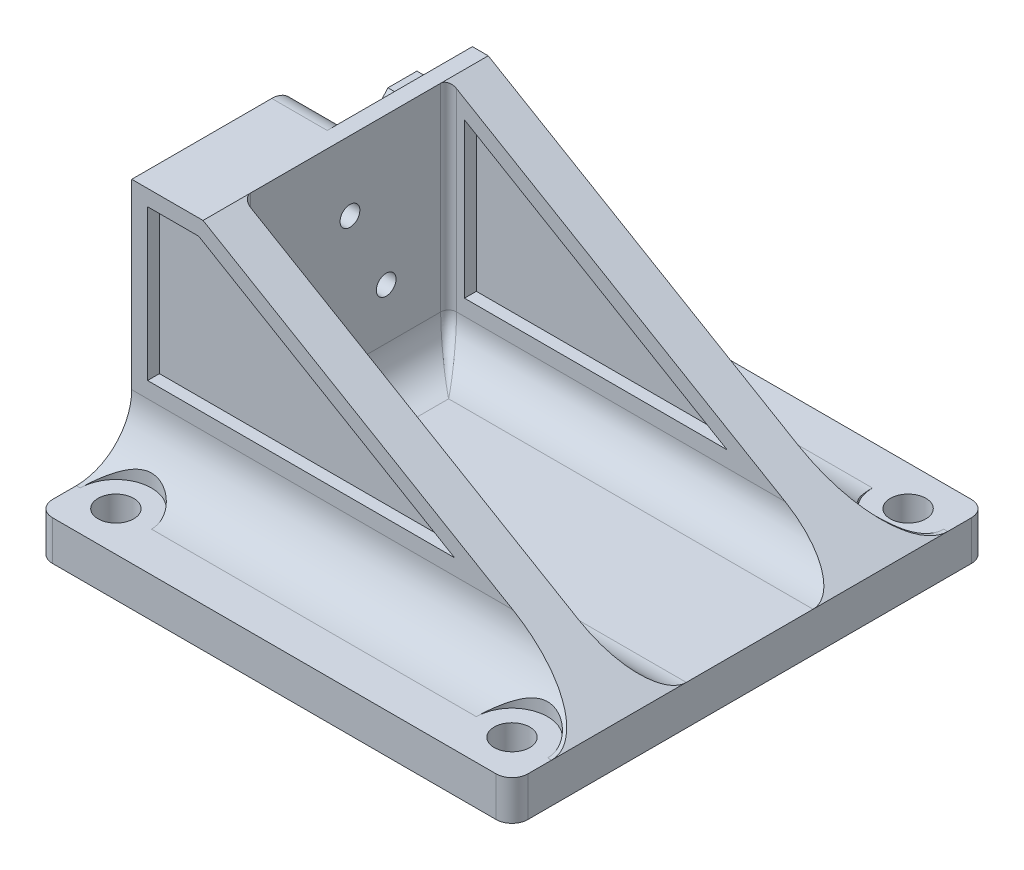
from build123d import *

# Parameters (mm, degrees)
SKETCH2_W                     = 60
SKETCH2_H                     = 60
BOSS_EXTRUDE1_DEPTH           = 5
SKETCH5_W                     = 9
SKETCH5_H                     = 36
BOSS_EXTRUDE2_DEPTH           = 30
BOSS_EXTRUDE3_DEPTH           = 5
BOSS_EXTRUDE4_DEPTH           = 5
FILLET6_R                     = 7
SKETCH4_W                     = 2.25
SKETCH4_H                     = 5
M4_CLEARANCE_HOLE2_AT_2_COUNT = 2
M4_CLEARANCE_HOLE2_AT_2_PITCH = 70.710678119
M4_CLEARANCE_HOLE2_AT_3_COUNT = 2
M4_CLEARANCE_HOLE2_AT_3_PITCH = 50
M4_CLEARANCE_HOLE2_AT_4_COUNT = 2
M4_CLEARANCE_HOLE2_AT_4_PITCH = 50
SKETCH17_R                    = 4.5
CUT_EXTRUDE7_DEPTH            = 5
CUT_EXTRUDE8_DEPTH            = 3
RIB9_REACH                    = 57
SKETCH19_WALLS_W              = 3
SKETCH19_WALLS_H              = 168.00000011
FILLET7_R                     = 5
CUT_EXTRUDE10_DEPTH           = 1.5
FILLET8_R                     = 1
SKETCH23_R                    = 1.25
CUT_EXTRUDE12_DEPTH           = 76.663729878
CIRPATTERN2_COUNT             = 3
FILLET10_R                    = 2
SKETCH24_R                    = 8.875
CUT_EXTRUDE13_DEPTH           = 7
CUT_EXTRUDE14_DEPTH           = 7
FILLET11_R                    = 7
SKETCH27_W                    = 5
SKETCH27_H                    = 6.169574238
CUT_EXTRUDE17_DEPTH           = 7
CUT_EXTRUDE18_DEPTH           = 1.5
CUT_EXTRUDE19_DEPTH           = 1.5
FILLET13_R                    = 3


with BuildPart() as part:
    # Sketch2 → Boss-Extrude1 (new body)
    with BuildSketch(Plane(origin=(0, 0, 0), x_dir=(1, 0, 0), z_dir=(0, 1, 0))):
        Rectangle(SKETCH2_W, SKETCH2_H)
    extrude(amount=BOSS_EXTRUDE1_DEPTH)

    # Sketch5 → Boss-Extrude2 (add)
    with BuildSketch(Plane(origin=(0, 5, 0), x_dir=(1, 0, 0), z_dir=(0, 1, 0))):
        with Locations((-25.5, 0)):
            Rectangle(SKETCH5_W, SKETCH5_H)
    extrude(amount=BOSS_EXTRUDE2_DEPTH)

    # Sketch6 → Boss-Extrude3 (add)
    with BuildSketch(Plane.XY.offset(18)):
        Polygon((-21, 35), (30, 5), (-21, 5), align=None)
    extrude(amount=-BOSS_EXTRUDE3_DEPTH)

    # Sketch15 → Boss-Extrude4 (add)
    with BuildSketch(Plane(origin=(0, 0, -18), x_dir=(-1, 0, 0), z_dir=(0, 0, -1))):
        Polygon((21, 5), (21, 35), (-30, 5), align=None)
    extrude(amount=-BOSS_EXTRUDE4_DEPTH)

    # Fillet6
    fillet6_edges = [part.edges().sort_by_distance(p)[0] for p in [
        (0, 5, 18),
        (0, 5, -18),
    ]]
    fillet(fillet6_edges, radius=FILLET6_R)

    # Sketch4 → M4 Clearance Hole2 (revolve, cut)
    with BuildSketch(Plane(origin=(25, 5, -25), x_dir=(0, 0, 1), z_dir=(1, 0, 0))):
        with Locations((1.125, 2.5)):
            Rectangle(SKETCH4_W, SKETCH4_H)
    m4_clearance_hole2 = revolve(axis=Axis((25, 11.35, -25), (0, -1, 0)), mode=Mode.SUBTRACT)

    # M4 Clearance Hole2 at 2: M4 Clearance Hole2 ×2
    with Locations(*[Vector(-0.7071067811865476, 0, 0.7071067811865476) * (i * M4_CLEARANCE_HOLE2_AT_2_PITCH) for i in range(1, M4_CLEARANCE_HOLE2_AT_2_COUNT)]):
        add(m4_clearance_hole2, mode=Mode.SUBTRACT)

    # M4 Clearance Hole2 at 3: M4 Clearance Hole2 ×2
    with Locations(*[(-i * M4_CLEARANCE_HOLE2_AT_3_PITCH, 0, 0) for i in range(1, M4_CLEARANCE_HOLE2_AT_3_COUNT)]):
        add(m4_clearance_hole2, mode=Mode.SUBTRACT)

    # M4 Clearance Hole2 at 4: M4 Clearance Hole2 ×2
    with Locations(*[(0, 0, i * M4_CLEARANCE_HOLE2_AT_4_PITCH) for i in range(1, M4_CLEARANCE_HOLE2_AT_4_COUNT)]):
        add(m4_clearance_hole2, mode=Mode.SUBTRACT)

    # Sketch17 → Cut-Extrude7 (cut)
    with BuildSketch(Plane(origin=(0, 5, 0), x_dir=(1, 0, 0), z_dir=(0, 1, 0))):
        with Locations((25, -25)):
            Circle(SKETCH17_R)
        with Locations((-25, -25)):
            Circle(SKETCH17_R)
        with Locations((-25, 25)):
            Circle(SKETCH17_R)
        with Locations((25, 25)):
            Circle(SKETCH17_R)
    extrude(amount=CUT_EXTRUDE7_DEPTH, mode=Mode.SUBTRACT)

    # Sketch18 → Cut-Extrude8 (cut)
    with BuildSketch(Plane.XZ):
        with BuildLine():
            Line((-28, 21.989601355), (-28, -21.989601355))
            ThreePointArc((-28, -21.989601355), (-21.99479618, -21.99479618), (-21.989601355, -28))
            Line((-21.989601355, -28), (21.989601355, -28))
            ThreePointArc((21.989601355, -28), (21.99479618, -21.99479618), (28, -21.989601355))
            Line((28, -21.989601355), (28, 21.989601355))
            ThreePointArc((28, 21.989601355), (21.99479618, 21.99479618), (21.989601355, 28))
            Line((21.989601355, 28), (-21.989601355, 28))
            ThreePointArc((-21.989601355, 28), (-21.99479618, 21.99479618), (-28, 21.989601355))
        make_face()
    extrude(amount=-CUT_EXTRUDE8_DEPTH, mode=Mode.SUBTRACT)

    # Sketch19 walls → Rib9 (add, up to next)
    with BuildSketch(Plane.XZ, mode=Mode.PRIVATE) as rib9_sk1:
        with Locations((15.5, 0)):
            Rectangle(SKETCH19_WALLS_W, SKETCH19_WALLS_H)
    rib9_tool1 = extrude(rib9_sk1.sketch, amount=-RIB9_REACH, mode=Mode.PRIVATE) - part.part
    # Sketch19 walls → Rib9 (add, up to next)
    with BuildSketch(Plane.XZ, mode=Mode.PRIVATE) as rib9_sk2:
        with Locations((-15.5, 0)):
            Rectangle(SKETCH19_WALLS_W, SKETCH19_WALLS_H)
    rib9_tool2 = extrude(rib9_sk2.sketch, amount=-RIB9_REACH, mode=Mode.PRIVATE) - part.part
    add(rib9_tool1.solids().sort_by_distance((15.5, 0, 0))[0])
    add(rib9_tool2.solids().sort_by_distance((-15.5, 0, 0))[0])

    # Fillet7
    # the kernel refuses this fillet: 5 mm, written as the material it adds along each edge
    with BuildSketch(Plane(origin=(-21, 5, 13), x_dir=(1, 0, 0), z_dir=(0, 0, -1))) as fillet7_piece_1:
        with BuildLine():
            CenterArc((FILLET7_R, -FILLET7_R), FILLET7_R, 90, 90)
            Line((0, -FILLET7_R), (0, 0))
            Line((0, 0), (FILLET7_R, 0))
        make_face()
    extrude(amount=26)
    with BuildSketch(Plane(origin=(42.5, 5, 13), x_dir=(0, 0, -1), z_dir=(-1, 0, 0))) as fillet7_piece_2_section:
        with BuildLine():
            CenterArc((FILLET7_R, -FILLET7_R), FILLET7_R, 90, 90)
            Line((0, -FILLET7_R), (0, 0))
            Line((0, 0), (FILLET7_R, 0))
        make_face()
    fillet7_piece_2 = extrude(amount=63.5, mode=Mode.PRIVATE)
    fillet7_piece_2 = split(fillet7_piece_2, bisect_by=Plane(origin=(9.894433322, 16.826803928, 11.865257735), z_dir=(-0.5070201265633938, -0.8619342151577696, 0)), keep=Keep.TOP, mode=Mode.PRIVATE)
    add(fillet7_piece_2)
    with BuildSketch(Plane(origin=(42.5, 5, -13), x_dir=(0, 0, 1), z_dir=(-1, 0, 0))) as fillet7_piece_3_section:
        with BuildLine():
            CenterArc((FILLET7_R, FILLET7_R), FILLET7_R, 180, 90)
            Line((0, FILLET7_R), (0, 0))
            Line((0, 0), (FILLET7_R, 0))
        make_face()
    fillet7_piece_3 = extrude(amount=63.5, mode=Mode.PRIVATE)
    fillet7_piece_3 = split(fillet7_piece_3, bisect_by=Plane(origin=(9.894433322, 16.826803928, -11.865257735), z_dir=(-0.5070201265633937, -0.8619342151577696, 0)), keep=Keep.TOP, mode=Mode.PRIVATE)
    add(fillet7_piece_3)

    # Sketch21 → Cut-Extrude10 (cut)
    with BuildSketch(Plane.XY.offset(-13)):
        Polygon((-19, 31.503166715), (-19, 12), (14.155383415, 12), align=None)
    cut_extrude10 = extrude(amount=-CUT_EXTRUDE10_DEPTH, mode=Mode.SUBTRACT)

    # Fillet8
    fillet8_edges = [part.edges().sort_by_distance(p)[0] for p in [
        (-21, 22.5, 13),
        (-21, 22.5, -13),
        (-19.230244537, 6.183519916, 11.230244537),
        (-19.230244537, 6.183519916, -11.230244537),
    ]]
    fillet(fillet8_edges, radius=FILLET8_R)

    # Mirror3: Cut-Extrude10 across plane
    add(cut_extrude10.mirror(Plane.XY), mode=Mode.SUBTRACT)

    # Sketch23 → Cut-Extrude12 (cut, through all)
    with BuildSketch(Plane(origin=(-30, 0, 0), x_dir=(0, 0, -1), z_dir=(1, 0, 0))):
        with Locations(Location((0.544723392, 26.226216863, 0), (0, 0, 180))):
            Circle(SKETCH23_R)
    cut_extrude12 = extrude(amount=CUT_EXTRUDE12_DEPTH, mode=Mode.SUBTRACT)

    # CirPattern2: Cut-Extrude12 ×3 about axis
    cirpattern2_axis = Axis((0, 20, 0), (1, 0, 0))
    for i in range(1, CIRPATTERN2_COUNT):
        add(cut_extrude12.rotate(cirpattern2_axis, i * 360 / CIRPATTERN2_COUNT), mode=Mode.SUBTRACT)

    # Fillet10
    fillet10_edges = [part.edges().sort_by_distance(p)[0] for p in [
        (-30, 2.5, -30),
        (-30, 2.5, 30),
        (30, 2.5, 30),
        (30, 2.5, -30),
    ]]
    fillet(fillet10_edges, radius=FILLET10_R)

    # Sketch24 → Cut-Extrude13 (cut)
    with BuildSketch(Plane.ZY.offset(30)):
        with Locations((0, 20)):
            Circle(SKETCH24_R)
    extrude(amount=-CUT_EXTRUDE13_DEPTH, mode=Mode.SUBTRACT)

    # Sketch25 → Cut-Extrude14 (cut)
    with BuildSketch(Plane.ZY.offset(30)):
        Polygon((-1.486450158, 28.74963376), (-10.151392059, 38.373026676), (-17.792172557, 39.760209508), (-17.211267901, 32.016285915), (-8.546326, 22.392892999), align=None)
    extrude(amount=-CUT_EXTRUDE14_DEPTH, mode=Mode.SUBTRACT)

    # Fillet11
    fillet11_edges = [part.edges().sort_by_distance(p)[0] for p in [
        (-26.5, 28.74963376, -1.486450158),
        (-26.5, 22.392892999, -8.546326),
    ]]
    fillet(fillet11_edges, radius=FILLET11_R)

    # Sketch27 → Cut-Extrude17 (cut)
    with BuildSketch(Plane.ZY.offset(30)):
        with Locations((-15.5, 31.915212881)):
            Rectangle(SKETCH27_W, SKETCH27_H)
    extrude(amount=-CUT_EXTRUDE17_DEPTH, mode=Mode.SUBTRACT)

    # Sketch28 → Cut-Extrude18 (cut)
    with BuildSketch(Plane(origin=(0, 0, -18), x_dir=(-1, 0, 0), z_dir=(0, 0, -1))):
        Polygon((28, 14), (28, 26.830425762), (21, 26.830425762), (21, 32.679637303), (-10.755383415, 14), align=None)
    extrude(amount=-CUT_EXTRUDE18_DEPTH, mode=Mode.SUBTRACT)

    # Sketch29 → Cut-Extrude19 (cut)
    with BuildSketch(Plane.XY.offset(18)):
        Polygon((10.755383415, 14), (-21.544616585, 33), (-28, 33), (-28, 14), align=None)
    extrude(amount=-CUT_EXTRUDE19_DEPTH, mode=Mode.SUBTRACT)

    # Fillet13
    # the kernel refuses this fillet: 3 mm, written as the material it takes off along each edge
    with BuildSketch(Plane(origin=(-51.842425733, 35, -7.114305199), x_dir=(0, -0.6691623373486353, 0.7431162535391829), z_dir=(1, 0, 0))) as fillet13_piece_1:
        with BuildLine():
            CenterArc((7.536318289, -2.749260767), FILLET13_R, 66.408234173, 161.58931935)
            Line((5.528831277, -4.978609528), (5.328082575, -5.201544404))
            Line((5.328082575, -5.201544404), (-0.200748701, -0.222934876))
            Line((-0.200748701, -0.222934876), (-0.031345799, 0.298357907))
            ThreePointArc((-0.031345799, 0.298357907), (5.172701164, 0.845100622), (8.857035494, 0.274926077))
            Line((8.857035494, 0.274926077), (8.736970293, 0))
        make_face()
    extrude(amount=28.842425733, mode=Mode.SUBTRACT)


solid = part.part
